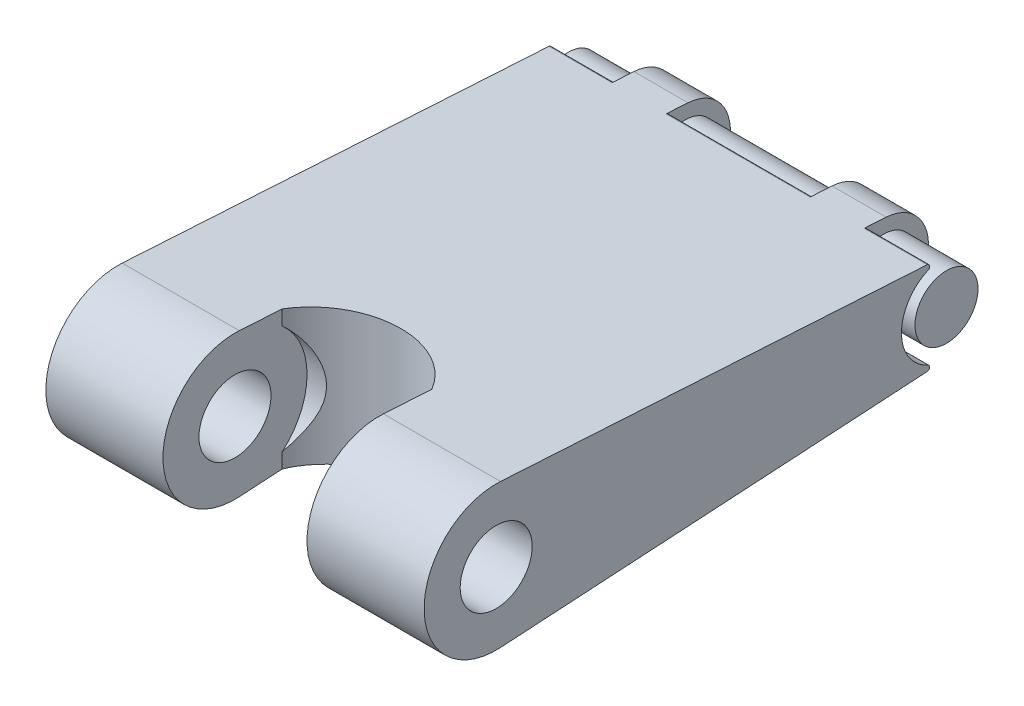
from build123d import *

# Parameters (mm, degrees)
SKETCH1_R           = 8
SKETCH1_R_2         = 4
SKETCH1_R_3         = 5
SKETCH1_R_4         = 3.5
BOSS_EXTRUDE1_DEPTH = 21
SKETCH1_4_R         = 8
SKETCH1_4_R_2       = 4
CUT_EXTRUDE1_DEPTH  = 8
SKETCH1_5_R         = 5
SKETCH1_5_R_2       = 3.5
CUT_EXTRUDE2_DEPTH  = 8
CUT_EXTRUDE3_START  = 21
SKETCH1_6_R         = 5
SKETCH1_6_R_2       = 3.5
CUT_EXTRUDE3_DEPTH  = 7
CUT_EXTRUDE4_START  = -14
SKETCH1_7_R         = 5
SKETCH1_7_R_2       = 3.5
CUT_EXTRUDE4_DEPTH  = 7
FILLET2_START       = -8
FILLET2_DEPTH       = 16
FILLET2_START_2     = -22
FILLET2_2_DEPTH     = 8
FILLET2_START_3     = 14
FILLET2_3_DEPTH     = 8
CUT_EXTRUDE5_DEPTH  = 10


with BuildPart() as part:
    # Sketch1 → Boss-Extrude1 (new, symmetric)
    # profile 1 of 4: a face of its own
    with BuildSketch(Plane(origin=(0, 0, 0), x_dir=(0, 0, -1), z_dir=(1, 0, 0))):
        with BuildLine():
            Line((50.3, 4.990991885), (0.48, 7.985587017))
            ThreePointArc((0.48, 7.985587017), (5.824087911, 5.48452368), (8, 0))
            ThreePointArc((8, 0), (5.824087911, -5.48452368), (0.48, -7.985587017))
            Line((0.48, -7.985587017), (50.3, -4.990991885))
            ThreePointArc((50.3, -4.990991885), (45, 0), (50.3, 4.990991885))
        make_face()
    # profile 2 of 4: a face of its own
    with BuildSketch(Plane(origin=(0, 0, 0), x_dir=(0, 0, -1), z_dir=(1, 0, 0))):
        Circle(SKETCH1_R)
        with Locations(Location((0, 0, 0), (0, 0, 180))):
            Circle(SKETCH1_R_2, mode=Mode.SUBTRACT)
    # profile 3 of 4: a face of its own
    with BuildSketch(Plane(origin=(0, 0, 0), x_dir=(0, 0, -1), z_dir=(1, 0, 0))):
        with Locations((50, 0)):
            Circle(SKETCH1_R_3)
        with Locations((50, 0)):
            Circle(SKETCH1_R_4, mode=Mode.SUBTRACT)
    # profile 4 of 4: a face of its own
    with BuildSketch(Plane(origin=(0, 0, 0), x_dir=(0, 0, -1), z_dir=(1, 0, 0))):
        with Locations((50, 0)):
            Circle(SKETCH1_R_4)
    extrude(amount=BOSS_EXTRUDE1_DEPTH, both=True)

    # Sketch1<4> → Cut-Extrude1 (cut, symmetric)
    with BuildSketch(Plane(origin=(0, 0, 0), x_dir=(0, 0, -1), z_dir=(1, 0, 0))):
        Circle(SKETCH1_4_R)
        with Locations(Location((0, 0, 0), (0, 0, 180))):
            Circle(SKETCH1_4_R_2, mode=Mode.SUBTRACT)
    extrude(amount=CUT_EXTRUDE1_DEPTH, both=True, mode=Mode.SUBTRACT)

    # Sketch1<5> → Cut-Extrude2 (cut, symmetric)
    with BuildSketch(Plane(origin=(0, 0, 0), x_dir=(0, 0, -1), z_dir=(1, 0, 0))):
        with Locations((50, 0)):
            Circle(SKETCH1_5_R)
        with Locations((50, 0)):
            Circle(SKETCH1_5_R_2, mode=Mode.SUBTRACT)
    extrude(amount=CUT_EXTRUDE2_DEPTH, both=True, mode=Mode.SUBTRACT)

    # Sketch1<6> → Cut-Extrude3 (cut)
    with BuildSketch(Plane(origin=(0, 0, 0), x_dir=(0, 0, -1), z_dir=(1, 0, 0)).offset(CUT_EXTRUDE3_START)):
        with Locations((50, 0)):
            Circle(SKETCH1_6_R)
        with Locations((50, 0)):
            Circle(SKETCH1_6_R_2, mode=Mode.SUBTRACT)
    extrude(amount=-CUT_EXTRUDE3_DEPTH, mode=Mode.SUBTRACT)

    # Sketch1<7> → Cut-Extrude4 (cut)
    with BuildSketch(Plane(origin=(0, 0, 0), x_dir=(0, 0, -1), z_dir=(1, 0, 0)).offset(CUT_EXTRUDE4_START)):
        with Locations((50, 0)):
            Circle(SKETCH1_7_R)
        with Locations((50, 0)):
            Circle(SKETCH1_7_R_2, mode=Mode.SUBTRACT)
    extrude(amount=-CUT_EXTRUDE4_DEPTH, mode=Mode.SUBTRACT)

    # Fillet2: read off the stored shape, not the designer's step
    # Fillet2 outline → Fillet2 (cut)
    with BuildSketch(Plane.YZ.offset(FILLET2_START)):
        with BuildLine():
            ThreePointArc((-4.990991885, -50.3), (-4.9190545, -49.10395155), (-4.564624299, -47.959361617))
            ThreePointArc((-4.564624299, -47.959361617), (-4.892264664, -48.132066584), (-5.13796127, -47.854923314))
            Line((-5.13796127, -47.854923314), (-4.990991885, -50.3))
        make_face()
        with BuildLine():
            ThreePointArc((5.13796127, -47.854923314), (4.892264664, -48.132066584), (4.564624299, -47.959361617))
            ThreePointArc((4.564624299, -47.959361617), (4.9190545, -49.10395155), (4.990991885, -50.3))
            Line((4.990991885, -50.3), (5.13796127, -47.854923314))
        make_face()
    extrude(amount=FILLET2_DEPTH, mode=Mode.SUBTRACT)

    # Fillet2 2 outline → Fillet2 2 (cut)
    with BuildSketch(Plane.YZ.offset(FILLET2_START_2)):
        with BuildLine():
            ThreePointArc((-4.990991885, -50.3), (-4.9190545, -49.10395155), (-4.564624299, -47.959361617))
            ThreePointArc((-4.564624299, -47.959361617), (-4.892264664, -48.132066584), (-5.13796127, -47.854923314))
            Line((-5.13796127, -47.854923314), (-4.990991885, -50.3))
        make_face()
        with BuildLine():
            ThreePointArc((5.13796127, -47.854923314), (4.892264664, -48.132066584), (4.564624299, -47.959361617))
            ThreePointArc((4.564624299, -47.959361617), (4.9190545, -49.10395155), (4.990991885, -50.3))
            Line((4.990991885, -50.3), (5.13796127, -47.854923314))
        make_face()
    extrude(amount=FILLET2_2_DEPTH, mode=Mode.SUBTRACT)

    # Fillet2 3 outline → Fillet2 3 (cut)
    with BuildSketch(Plane.YZ.offset(FILLET2_START_3)):
        with BuildLine():
            ThreePointArc((-4.990991885, -50.3), (-4.9190545, -49.10395155), (-4.564624299, -47.959361617))
            ThreePointArc((-4.564624299, -47.959361617), (-4.892264664, -48.132066584), (-5.13796127, -47.854923314))
            Line((-5.13796127, -47.854923314), (-4.990991885, -50.3))
        make_face()
        with BuildLine():
            ThreePointArc((5.13796127, -47.854923314), (4.892264664, -48.132066584), (4.564624299, -47.959361617))
            ThreePointArc((4.564624299, -47.959361617), (4.9190545, -49.10395155), (4.990991885, -50.3))
            Line((4.990991885, -50.3), (5.13796127, -47.854923314))
        make_face()
    extrude(amount=FILLET2_3_DEPTH, mode=Mode.SUBTRACT)

    # Sketch3 → Cut-Extrude5 (cut, symmetric)
    with BuildSketch(Plane(origin=(0, 0, 0), x_dir=(1, 0, 0), z_dir=(0, 1, 0))):
        with BuildLine():
            Line((-8, -3.76), (8, -3.76))
            Line((8, -3.76), (8, 5.858563907))
            ThreePointArc((8, 5.858563907), (-0.18107936, 10.23314684), (-8, 5.24))
            Line((-8, 5.24), (-8, -3.76))
        make_face()
    extrude(amount=CUT_EXTRUDE5_DEPTH, both=True, mode=Mode.SUBTRACT)


solid = part.part
